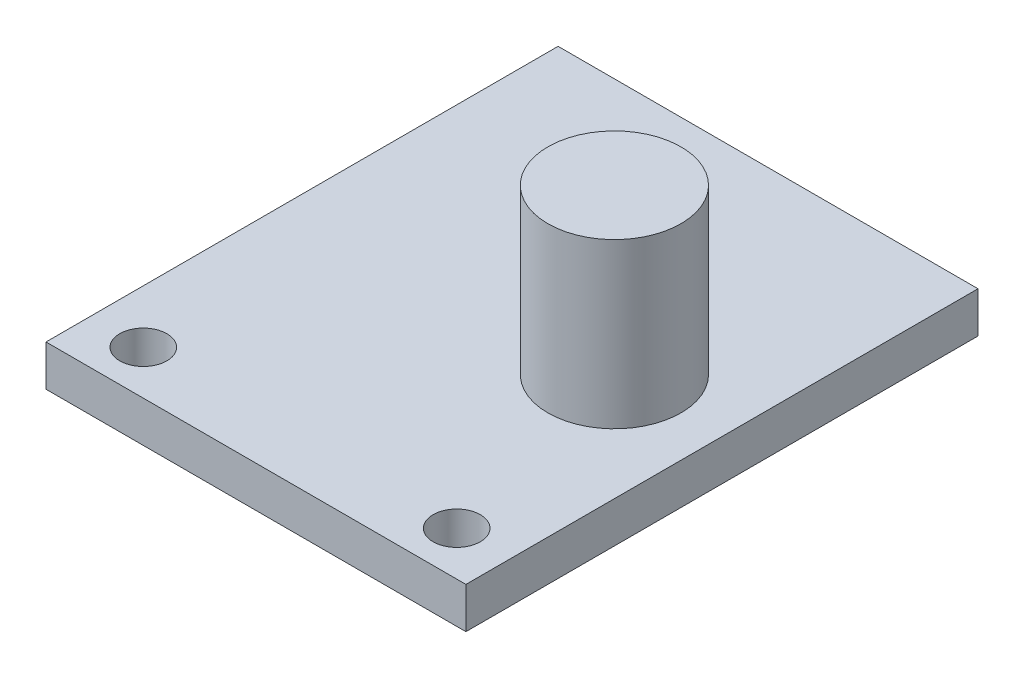
from build123d import *

# Parameters (mm, degrees)
SKETCH1_W           = 20.5
SKETCH1_H           = 25
BOSS_EXTRUDE1_DEPTH = 2
SKETCH2_R           = 1.15
CUT_EXTRUDE1_DEPTH  = 17.288416129
SKETCH3_R           = 3.25
BOSS_EXTRUDE2_DEPTH = 8


with BuildPart() as part:
    # Sketch1 → Boss-Extrude1 (new body)
    with BuildSketch(Plane(origin=(0, 0, 0), x_dir=(1, 0, 0), z_dir=(0, 1, 0))):
        Rectangle(SKETCH1_W, SKETCH1_H)
    extrude(amount=BOSS_EXTRUDE1_DEPTH)

    # Sketch2 → Cut-Extrude1 (cut, through all)
    with BuildSketch(Plane(origin=(0, 2, 0), x_dir=(1, 0, 0), z_dir=(0, 1, 0))):
        with Locations((7.65, -10.35)):
            Circle(SKETCH2_R)
        with Locations((-7.65, -10.35)):
            Circle(SKETCH2_R)
    extrude(amount=-CUT_EXTRUDE1_DEPTH, mode=Mode.SUBTRACT)

    # Sketch3 → Boss-Extrude2 (add)
    with BuildSketch(Plane(origin=(0, 2, 0), x_dir=(1, 0, 0), z_dir=(0, 1, 0))):
        with Locations((5, 0)):
            Circle(SKETCH3_R)
    extrude(amount=BOSS_EXTRUDE2_DEPTH)


solid = part.part
